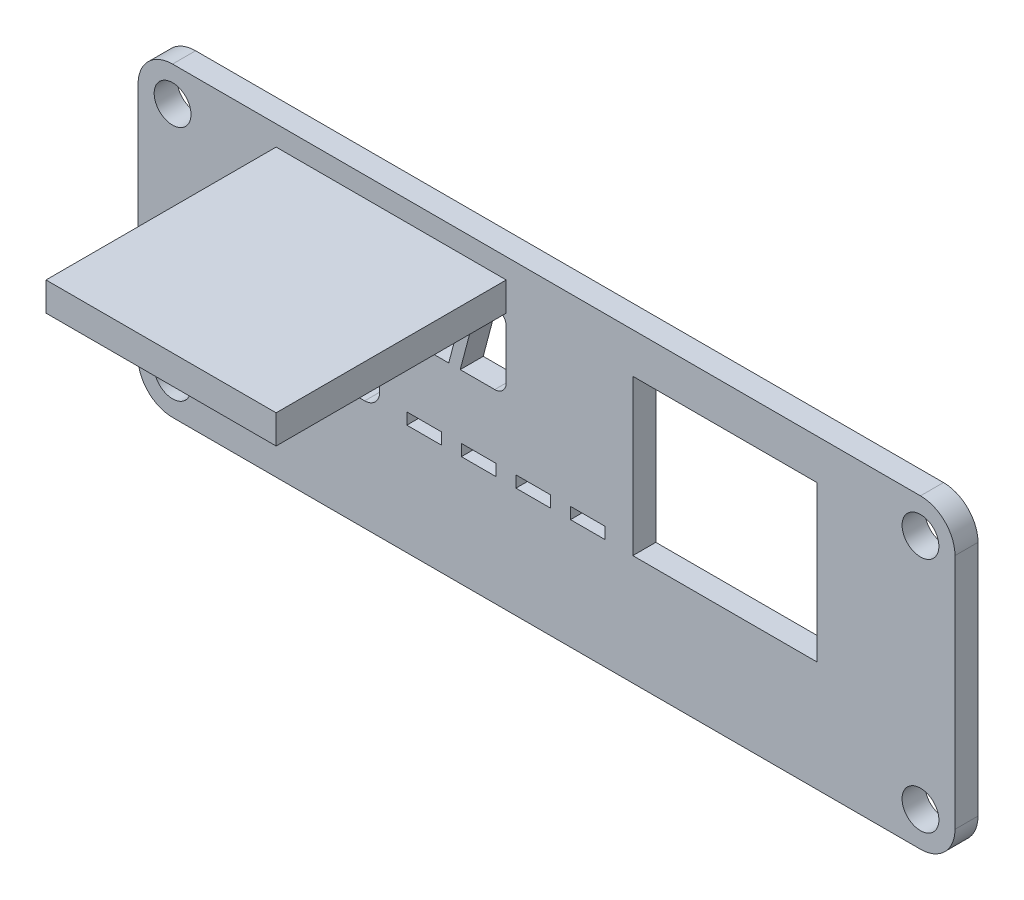
from build123d import *

# Parameters (mm, degrees)
SKETCH_1_R          = 1.6
EXTRUDE_1_DEPTH     = 2
SKETCH_2_W          = 16
SKETCH_2_H          = 13.5
SKETCH_2_W_2        = 3
SKETCH_2_H_2        = 1
CUT_EXTRUDE_2_DEPTH = 2
SKETCH_3_W          = 20
SKETCH_3_H          = 2.5
EXTRUDE_2_DEPTH     = 20
CUT_EXTRUDE_3_DEPTH = 20


with BuildPart() as part:
    # 草图1 → 凸台-拉伸1 (new body)
    with BuildSketch(Plane.XY):
        with BuildLine():
            Line((3, 0), (68, 0))
            ThreePointArc((68, 0), (70.121320344, -0.878679656), (71, -3))
            Line((71, -3), (71, -23.6))
            ThreePointArc((71, -23.6), (70.121320344, -25.721320344), (68, -26.6))
            Line((68, -26.6), (3, -26.6))
            ThreePointArc((3, -26.6), (0.878679656, -25.721320344), (0, -23.6))
            Line((0, -23.6), (0, -3))
            ThreePointArc((0, -3), (0.878679656, -0.878679656), (3, 0))
        make_face()
        with Locations((3, -3)):
            Circle(SKETCH_1_R, mode=Mode.SUBTRACT)
        with Locations((68, -3)):
            Circle(SKETCH_1_R, mode=Mode.SUBTRACT)
        with Locations((68, -23.6)):
            Circle(SKETCH_1_R, mode=Mode.SUBTRACT)
        with Locations((3, -23.6)):
            Circle(SKETCH_1_R, mode=Mode.SUBTRACT)
    extrude(amount=EXTRUDE_1_DEPTH)

    # 草图2 → 切除-拉伸2 (cut)
    with BuildSketch(Plane(origin=(0, 0, 0), x_dir=(-1, 0, 0), z_dir=(0, 0, -1))):
        with Locations((-51, -10.25)):
            Rectangle(SKETCH_2_W, SKETCH_2_H)
        with BuildLine():
            Line((-19.7, -17), (-13.1, -17))
            ThreePointArc((-13.1, -17), (-12.180761184, -16.619238816), (-11.8, -15.7))
            Line((-11.8, -15.7), (-11.8, -14.9))
            ThreePointArc((-11.8, -14.9), (-12.180761184, -13.980761184), (-13.1, -13.6))
            Line((-13.1, -13.6), (-19.7, -13.6))
            ThreePointArc((-19.7, -13.6), (-20.619238816, -13.980761184), (-21, -14.9))
            Line((-21, -14.9), (-21, -15.7))
            ThreePointArc((-21, -15.7), (-20.619238816, -16.619238816), (-19.7, -17))
        make_face()
        with Locations((-39.084, -16.5)):
            Rectangle(SKETCH_2_W_2, SKETCH_2_H_2)
        with Locations((-34.343, -16.5)):
            Rectangle(SKETCH_2_W_2, SKETCH_2_H_2)
        with Locations((-29.601, -16.5)):
            Rectangle(SKETCH_2_W_2, SKETCH_2_H_2)
        with Locations((-24.86, -16.5)):
            Rectangle(SKETCH_2_W_2, SKETCH_2_H_2)
    extrude(amount=-CUT_EXTRUDE_2_DEPTH, mode=Mode.SUBTRACT)

    # 草图3 → 凸台-拉伸2 (add)
    with BuildSketch(Plane.XY.offset(2)):
        with Locations((22, -3)):
            Rectangle(SKETCH_3_W, SKETCH_3_H)
    extrude(amount=EXTRUDE_2_DEPTH)

    # 草图5 → 切除-拉伸3 (cut)
    with BuildSketch(Plane.XY.offset(2)):
        with BuildLine():
            Line((14.347228721, -10.5), (16, -4.25))
            Line((16, -4.25), (13, -4.25))
            ThreePointArc((13, -4.25), (12.292893219, -4.542893219), (12, -5.25))
            Line((12, -5.25), (12, -9.5))
            ThreePointArc((12, -9.5), (12.292893219, -10.207106781), (13, -10.5))
            Line((13, -10.5), (14.347228721, -10.5))
        make_face()
        Polygon((22.325, -4.25), (17, -4.25), (15.347228721, -10.5), (20.672228721, -10.5), align=None)
        Polygon((28.652771279, -4.25), (23.325, -4.25), (21.672228721, -10.5), (27, -10.5), align=None)
        with BuildLine():
            Line((31, -4.25), (29.652771279, -4.25))
            Line((29.652771279, -4.25), (28, -10.5))
            Line((28, -10.5), (31, -10.5))
            ThreePointArc((31, -10.5), (31.707106781, -10.207106781), (32, -9.5))
            Line((32, -9.5), (32, -5.25))
            ThreePointArc((32, -5.25), (31.707106781, -4.542893219), (31, -4.25))
        make_face()
    extrude(amount=-CUT_EXTRUDE_3_DEPTH, mode=Mode.SUBTRACT)


solid = part.part
